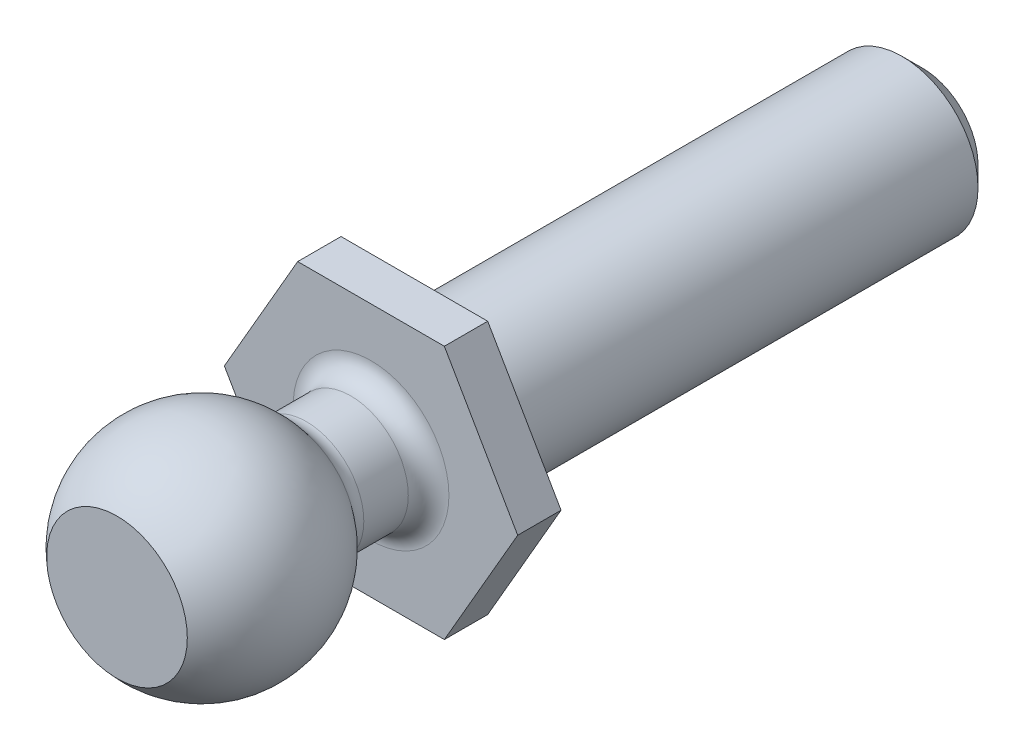
from build123d import *
from build123d.topology import SkipClean

# Parameters (mm, degrees)
BOSS_EXTRUDE1_DEPTH = 0.8128
SKETCH2_R           = 1.0795
BOSS_EXTRUDE2_DEPTH = 3.175
FILLET1_R           = 0.381
SKETCH4_R           = 1.4224
BOSS_EXTRUDE3_DEPTH = 9.525
CHAMFER1_SIZE       = 0.381


with BuildPart() as part:
    # Sketch1 → Boss-Extrude1 (new body)
    with BuildSketch(Plane.XY):
        Polygon((1.374815329, -2.38125), (2.749630657, 0), (1.374815329, 2.38125), (-1.374815329, 2.38125), (-2.749630657, 0), (-1.374815329, -2.38125), align=None)
    extrude(amount=BOSS_EXTRUDE1_DEPTH)

    # Sketch2 → Boss-Extrude2 (add)
    with BuildSketch(Plane.XY.offset(0.8128)):
        Circle(SKETCH2_R)
    extrude(amount=BOSS_EXTRUDE2_DEPTH)

    # Sketch3 → Revolve2 (revolve)
    with SkipClean():  # the faces are left unmerged after this step: merging them gives an invalid solid
        with BuildSketch(Plane.XY.offset(3.9878)):
            with BuildLine():
                ThreePointArc((0, 2.06375), (-2.06375, 0), (0, -2.06375))
                Line((0, -2.06375), (0, -1.0795))
                ThreePointArc((0, -1.0795), (-1.0795, 0), (0, 1.0795))
                Line((0, 1.0795), (0, 2.06375))
            make_face()
            with BuildLine():
                Line((0, -1.0795), (0, -2.06375))
                ThreePointArc((0, -2.06375), (1.45929162, -1.45929162), (2.06375, 0))
                ThreePointArc((2.06375, 0), (1.45929162, 1.45929162), (0, 2.06375))
                Line((0, 2.06375), (0, 1.0795))
                ThreePointArc((0, 1.0795), (0.76332177, 0.76332177), (1.0795, 0))
                ThreePointArc((1.0795, 0), (0.76332177, -0.76332177), (0, -1.0795))
            make_face()
        revolve(axis=Axis((0, -1000, 3.9878), (0, 1, 0)))
    add(part.part.scale(1), mode=Mode.REPLACE)  # the faces are merged on a copy

    # Fillet1
    fillet1_edges = [part.edges().sort_by_distance(p)[0] for p in [
        (-1.0795, 0, 0.8128),
        (-1.0795, 0, 2.228895849),
    ]]
    fillet(fillet1_edges, radius=FILLET1_R)

    # Sketch4 → Boss-Extrude3 (add)
    with BuildSketch(Plane(origin=(0, 0, 0), x_dir=(-1, 0, 0), z_dir=(0, 0, -1))):
        with Locations(Location((0, 0, 0), (0, 0, 180))):
            Circle(SKETCH4_R)
    extrude(amount=BOSS_EXTRUDE3_DEPTH)

    # Chamfer1
    chamfer1_edges = [part.edges().sort_by_distance(p)[0] for p in [
        (-1.4224, 0, -9.525),
    ]]
    chamfer(chamfer1_edges, length=CHAMFER1_SIZE)

    # Split1
    split(bisect_by=Plane.XY.offset(5.5753), keep=Keep.BOTTOM)


solid = part.part
